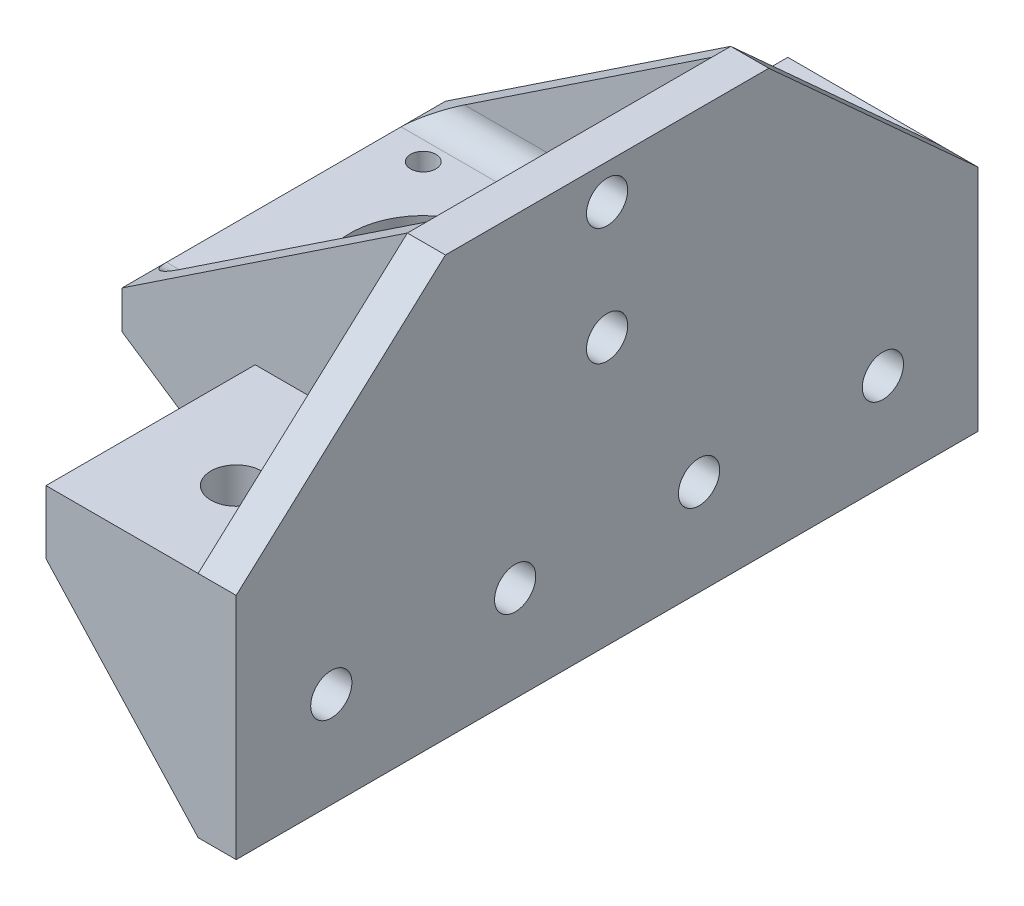
from build123d import *
from OCP.BRepFilletAPI import BRepFilletAPI_MakeFillet

# Parameters (mm, degrees)
SKETCH2_W                  = 45
SKETCH2_H                  = 45
BOSS_EXTRUDE1_DEPTH        = 6
SKETCH4_R                  = 11.5
SKETCH4_R_2                = 2
CUT_EXTRUDE1_DEPTH         = 64.921827258
BOSS_EXTRUDE2_DEPTH        = 30.1
BOSS_EXTRUDE2_DEPTH_BACK   = 36
SKETCH5_W                  = 6
SKETCH5_H                  = 45
BOSS_EXTRUDE3_DEPTH        = 3
BOSS_EXTRUDE4_DEPTH        = 3
BOSS_EXTRUDE5_DEPTH        = 28
BOSS_EXTRUDE6_DEPTH        = 5
FILLET3_R                  = 10
FILLET4_R1                 = 4
FILLET4_R2                 = 2
FILLET4_R3                 = 1.2
FILLET4_R4                 = 1.5
BOSS_EXTRUDE7_DEPTH        = 28
BOSS_EXTRUDE8_DEPTH        = 5
FILLET5_R                  = 10
F_6_5_6_5_DIAMETER_HOLE1_D = 6.5
SKETCH14_R                 = 4
CUT_EXTRUDE2_DEPTH         = 7.5
BOSS_EXTRUDE9_DEPTH        = 6


with BuildPart() as part:
    # Sketch2 → Boss-Extrude1 (new body)
    with BuildSketch(Plane(origin=(0, 0, 0), x_dir=(1, 0, 0), z_dir=(0, 1, 0))):
        with Locations((22.5, 22.5)):
            Rectangle(SKETCH2_W, SKETCH2_H)
    extrude(amount=BOSS_EXTRUDE1_DEPTH)

    # Sketch4 → Cut-Extrude1 (cut, through all)
    with BuildSketch(Plane(origin=(0, 6, 0), x_dir=(-1, 0, 0), z_dir=(0, 1, 0))):
        with Locations((-22, -22.5)):
            Circle(SKETCH4_R)
        with Locations((-37.5, -7)):
            Circle(SKETCH4_R_2)
        with Locations((-6.5, -7)):
            Circle(SKETCH4_R_2)
        with Locations((-6.5, -38)):
            Circle(SKETCH4_R_2)
        with Locations((-37.5, -38)):
            Circle(SKETCH4_R_2)
    extrude(amount=-CUT_EXTRUDE1_DEPTH, mode=Mode.SUBTRACT)

    # Sketch5 → Boss-Extrude2 (add, two sides: drawn at the far end of the back side and taken through both)
    with BuildSketch(Plane.XZ.offset(-BOSS_EXTRUDE2_DEPTH_BACK)):
        with Locations((48, -22.5)):
            Rectangle(SKETCH5_W, SKETCH5_H)
    extrude(amount=BOSS_EXTRUDE2_DEPTH + BOSS_EXTRUDE2_DEPTH_BACK)

    # Sketch8 → Boss-Extrude3 (add)
    with BuildSketch(Plane.XY):
        Polygon((45, 36), (0, 6), (0, 0), (45, -30.1), (51, -30.1), (51, 36), align=None)
    extrude(amount=BOSS_EXTRUDE3_DEPTH)

    # Sketch9 → Boss-Extrude4 (add)
    with BuildSketch(Plane(origin=(0, 0, -45), x_dir=(-1, 0, 0), z_dir=(0, 0, -1))):
        Polygon((0, 6), (-45, 36), (-51, 36), (-51, -30.1), (-45, -30.1), (0, 0), align=None)
    extrude(amount=BOSS_EXTRUDE4_DEPTH)

    # Sketch11 → Boss-Extrude5 (add)
    with BuildSketch(Plane.XY.offset(3)):
        Polygon((51, -30.1), (45, -30.1), (45, -4), (21, -4), (21, 6), (51, 6), align=None)
    extrude(amount=BOSS_EXTRUDE5_DEPTH)

    # Sketch12 → Boss-Extrude6 (add)
    with BuildSketch(Plane.XY.offset(31)):
        Polygon((45, -30.1), (21, -4), (21, 6), (51, 6), (51, -30.1), align=None)
    extrude(amount=BOSS_EXTRUDE6_DEPTH)

    # Fillet3
    fillet3_edges = [part.edges().sort_by_distance(p)[0] for p in [
        (33, -4, 31),
        (33, -4, 3),
    ]]
    fillet(fillet3_edges, radius=FILLET3_R)

    # Fillet4: one fillet with a radius per group of edges: ONE call of the kernel's fillet builder (fillet() takes one radius for all edges)
    fillet4_edges_1 = [part.edges().sort_by_distance(p)[0] for p in [
        (22.5, 6, -45),
        (22.5, 6, 0),
    ]]
    fillet4_edges_2 = [part.edges().sort_by_distance(p)[0] for p in [
        (45, 6, -22.5),
    ]]
    fillet4_edges_3 = [part.edges().sort_by_distance(p)[0] for p in [
        (22.5, 0, -45),
        (22.5, 0, 0),
    ]]
    fillet4_edges_4 = [part.edges().sort_by_distance(p)[0] for p in [
        (45, 0, -22.5),
    ]]
    fillet4 = BRepFilletAPI_MakeFillet(part.part.solid().wrapped)
    for e in fillet4_edges_1:
        fillet4.Add(FILLET4_R1, e.wrapped)
    for e in fillet4_edges_2:
        fillet4.Add(FILLET4_R2, e.wrapped)
    for e in fillet4_edges_3:
        fillet4.Add(FILLET4_R3, e.wrapped)
    for e in fillet4_edges_4:
        fillet4.Add(FILLET4_R4, e.wrapped)
    add(Compound.cast(fillet4.Shape()), mode=Mode.REPLACE)

    # Sketch15 → Boss-Extrude7 (add)
    with BuildSketch(Plane(origin=(0, 0, -48), x_dir=(-1, 0, 0), z_dir=(0, 0, -1))):
        Polygon((-51, -30.1), (-51, 6), (-21, 6), (-21, -4), (-45, -4), (-45, -30.1), align=None)
    extrude(amount=BOSS_EXTRUDE7_DEPTH)

    # Sketch16 → Boss-Extrude8 (add)
    with BuildSketch(Plane(origin=(0, 0, -76), x_dir=(-1, 0, 0), z_dir=(0, 0, -1))):
        Polygon((-45, -30.1), (-21, -4), (-21, 6), (-51, 6), (-51, -30.1), align=None)
    extrude(amount=BOSS_EXTRUDE8_DEPTH)

    # Fillet5
    fillet5_edges = [part.edges().sort_by_distance(p)[0] for p in [
        (33, -4, -48),
        (33, -4, -76),
    ]]
    fillet(fillet5_edges, radius=FILLET5_R)

    # Ø6.5 (6.5) Diameter Hole1 (through all)
    with Locations(Plane.ZY.offset(-45)):
        with Locations((-22.5, 12), (-22.5, 30.5), (-37, -15), (-8, -15), (21, -15), (-66, -15)):
            Hole(F_6_5_6_5_DIAMETER_HOLE1_D / 2)

    # Sketch14 → Cut-Extrude2 (cut)
    with BuildSketch(Plane(origin=(0, 6, 0), x_dir=(1, 0, 0), z_dir=(0, 1, 0))):
        with Locations((36, -21)):
            Circle(SKETCH14_R)
        with Locations((36, 66)):
            Circle(SKETCH14_R)
    extrude(amount=-CUT_EXTRUDE2_DEPTH, mode=Mode.SUBTRACT)

    # Sketch17 → Boss-Extrude9 (add)
    with BuildSketch(Plane(origin=(51, 0, 0), x_dir=(0, 0, -1), z_dir=(1, 0, 0))):
        Polygon((-3, 36), (-36, 6), (-3, 6), align=None)
        Polygon((48, 36), (81, 6), (48, 6), align=None)
    extrude(amount=-BOSS_EXTRUDE9_DEPTH)


solid = part.part
